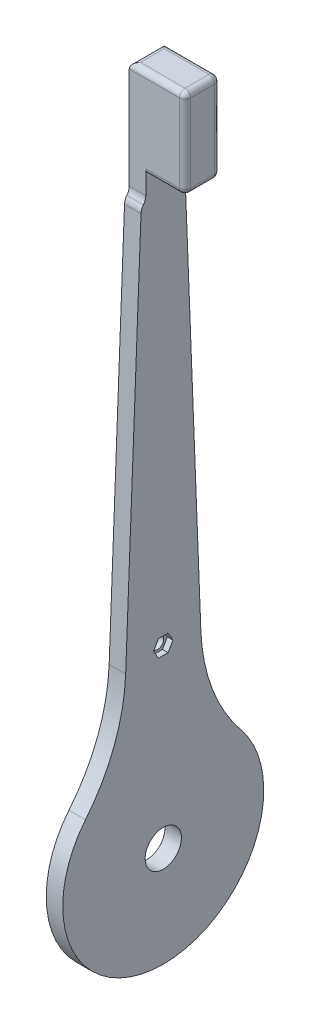
from build123d import *

# Parameters (mm, degrees)
SKETCH2_R                = 28.575
SKETCH2_R_2              = 11.1125
BOSS_EXTRUDE1_DEPTH      = 6.35
BOSS_EXTRUDE2_DEPTH      = 3.175
BOSS_EXTRUDE2_DEPTH_BACK = 1.524
SKETCH3_W                = 9.954249144
SKETCH3_H                = 25.4
BOSS_EXTRUDE3_DEPTH      = 11.176
SKETCH4_W                = 1.247460898
SKETCH4_H                = 31.75
CUT_EXTRUDE1_DEPTH       = 197.090385348
FILLET2_R                = 3.175
FILLET4_R                = 3.175
FILLET7_R                = 1.5875
SKETCH5_R                = 28.575
CUT_EXTRUDE2_DEPTH       = 197.296936937
SKETCH6_R                = 28.575
BOSS_EXTRUDE4_DEPTH      = 4.699
F_3_8_CLEARANCE_HOLE1_D  = 10.31748
FILLET9_R                = 50.8
F_4_CLEARANCE_HOLE1_D    = 3.4544
CUT_EXTRUDE3_DEPTH       = 1.6002


with BuildPart() as part:
    # Sketch2 → Boss-Extrude1 (new body)
    with BuildSketch(Plane(origin=(0, 0, 0), x_dir=(0, 0, -1), z_dir=(1, 0, 0))):
        Circle(SKETCH2_R)
        Circle(SKETCH2_R_2, mode=Mode.SUBTRACT)
    extrude(amount=-BOSS_EXTRUDE1_DEPTH)

    # Sketch2<5> → Boss-Extrude2 (add, two sides: drawn at the far end of the back side and taken through both)
    with BuildSketch(Plane(origin=(0, 0, 0), x_dir=(0, 0, -1), z_dir=(1, 0, 0)).offset(-BOSS_EXTRUDE2_DEPTH_BACK)):
        with BuildLine():
            Line((11.55989339, 26.132345662), (4.977124572, 193.675))
            Line((4.977124572, 193.675), (0, 193.675))
            Line((0, 193.675), (0, 28.575))
            ThreePointArc((0, 28.575), (5.907573431, 27.957668021), (11.55989339, 26.132345662))
        make_face()
        with BuildLine():
            Line((0, 28.575), (0, 193.675))
            Line((0, 193.675), (-4.977124572, 193.675))
            Line((-4.977124572, 193.675), (-11.55989339, 26.132345662))
            ThreePointArc((-11.55989339, 26.132345662), (-5.907573431, 27.957668021), (0, 28.575))
        make_face()
    extrude(amount=BOSS_EXTRUDE2_DEPTH + BOSS_EXTRUDE2_DEPTH_BACK)

    # Sketch3 → Boss-Extrude3 (add)
    with BuildSketch(Plane(origin=(3.175, 0, 0), x_dir=(0, 0, -1), z_dir=(1, 0, 0))):
        with Locations((0, 180.975)):
            Rectangle(SKETCH3_W, SKETCH3_H)
    extrude(amount=BOSS_EXTRUDE3_DEPTH)

    # Sketch4 → Cut-Extrude1 (cut, through all)
    with BuildSketch(Plane(origin=(3.175, 0, 0), x_dir=(0, 0, -1), z_dir=(1, 0, 0))):
        with Locations((-5.600855021, 177.8)):
            Rectangle(SKETCH4_W, SKETCH4_H)
        with Locations((5.600855021, 177.8)):
            Rectangle(SKETCH4_W, SKETCH4_H)
    extrude(amount=-CUT_EXTRUDE1_DEPTH, mode=Mode.SUBTRACT)

    # Fillet2
    # the kernel refuses this fillet: 3.175 mm, written as the material it takes off along each edge
    with BuildSketch(Plane(origin=(9.358070531, 161.925, 6.22458547), x_dir=(0, -0.999229036240723, 0.039259815759068305), z_dir=(-1, 0, 0))) as fillet2_piece_1:
        with BuildLine():
            CenterArc((2.473228212, -3.175), FILLET2_R, 90, 52.598124578)
            Line((-0.048975085, -1.24649915), (-0.099419151, -1.207929133))
            ThreePointArc((-0.099419151, -1.207929133), (-0.087938586, -0.620756577), (-0.063451044, 0.002492998))
            Line((-0.063451044, 0.002492998), (0, 0.0635))
            Line((0, 0.0635), (2.473228212, 0.0635))
            Line((2.473228212, 0.0635), (2.473228212, 0))
        make_face()
    extrude(amount=17.065141061, mode=Mode.SUBTRACT)
    with BuildSketch(Plane(origin=(9.358070531, 161.925, -6.22458547), x_dir=(0, 0, 1), z_dir=(-1, 0, 0))) as fillet2_piece_2:
        with BuildLine():
            CenterArc((3.075453706, -2.595971358), FILLET2_R, 125.151875422, 52.598124578)
            Line((-0.097098484, -2.471321443), (-0.160549528, -2.468828445))
            Line((-0.160549528, -2.468828445), (-0.063451044, 0.002492998))
            Line((-0.063451044, 0.002492998), (0, 0.0635))
            ThreePointArc((0, 0.0635), (0.623730449, 0.0635), (1.210901041, 0.051919427))
            Line((1.210901041, 0.051919427), (1.247460897, 0))
        make_face()
    extrude(amount=17.065141061, mode=Mode.SUBTRACT)

    # Fillet4
    fillet4_edges = [part.edges().sort_by_distance(p)[0] for p in [
        (0.8255, 161.925, 4.977124572),
        (0.8255, 161.925, -4.977124572),
    ]]
    fillet(fillet4_edges, radius=FILLET4_R)

    # Fillet7
    fillet7_edges = [part.edges().sort_by_distance(p)[0] for p in [
        (6.4135, 193.675, 4.977124572),
        (6.4135, 193.675, -4.977124572),
        (-1.524, 193.675, 0),
        (8.763, 168.275, 4.977124572),
        (8.763, 168.275, -4.977124572),
        (14.351, 193.675, 0),
        (14.351, 180.975, 4.977124572),
        (14.351, 168.275, 0),
        (14.351, 180.975, -4.977124572),
    ]]
    fillet(fillet7_edges, radius=FILLET7_R)

    # Sketch5 → Cut-Extrude2 (cut, through all)
    with BuildSketch(Plane(origin=(0, 0, 0), x_dir=(0, 0, -1), z_dir=(1, 0, 0))):
        Circle(SKETCH5_R)
    extrude(amount=-CUT_EXTRUDE2_DEPTH, mode=Mode.SUBTRACT)

    # Sketch6 → Boss-Extrude4 (add)
    with BuildSketch(Plane(origin=(3.175, 0, 0), x_dir=(0, 0, -1), z_dir=(1, 0, 0))):
        Circle(SKETCH6_R)
    extrude(amount=-BOSS_EXTRUDE4_DEPTH)

    # 3/8 Clearance Hole1 (through all)
    with Locations(Plane(origin=(3.175, 0, 0), x_dir=(0, 0, -1), z_dir=(1, 0, 0))):
        with Locations((0, 0)):
            Hole(F_3_8_CLEARANCE_HOLE1_D / 2)

    # Fillet9
    fillet9_edges = [part.edges().sort_by_distance(p)[0] for p in [
        (0.8255, 26.132345662, -11.55989339),
        (0.8255, 26.132345662, 11.55989339),
    ]]
    fillet(fillet9_edges, radius=FILLET9_R)

    # #4 Clearance Hole1 (through all)
    with Locations(Plane(origin=(3.175, 0, 0), x_dir=(0, 0, -1), z_dir=(1, 0, 0))):
        with Locations((0, 49.88728048)):
            Hole(F_4_CLEARANCE_HOLE1_D / 2)

    # Sketch11 → Cut-Extrude3 (cut)
    with BuildSketch(Plane(origin=(3.175, 0, 0), x_dir=(0, 0, -1), z_dir=(1, 0, 0))):
        Polygon((-1.382344076, 47.492990308), (1.382344076, 47.492990308), (2.764688151, 49.88728048), (1.382344076, 52.281570653), (-1.382344076, 52.281570653), (-2.764688151, 49.88728048), align=None)
    extrude(amount=-CUT_EXTRUDE3_DEPTH, mode=Mode.SUBTRACT)


solid = part.part
